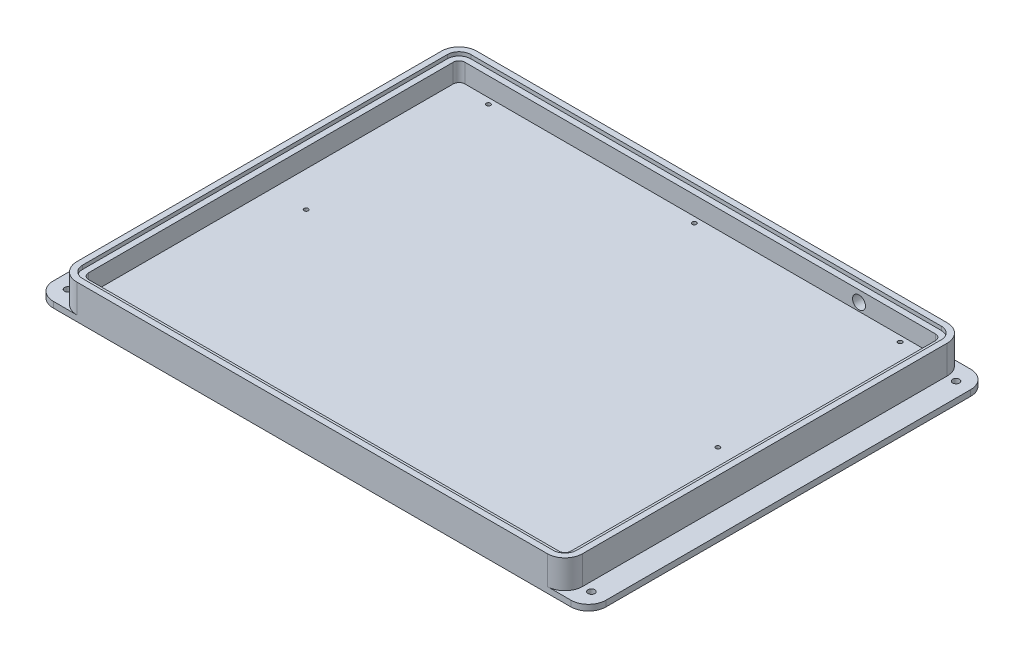
from build123d import *

# Parameters (mm, degrees)
SKETCH1_W           = 273.05
SKETCH1_H           = 215.9
BOSS_EXTRUDE1_DEPTH = 18.542
BOSS_EXTRUDE2_DEPTH = 3.175
FILLET1_R           = 9.525
CUT_EXTRUDE1_DEPTH  = 12.192
CUT_EXTRUDE2_DEPTH  = 2.032
SKETCH5_R           = 1.1303
CUT_EXTRUDE3_DEPTH  = 4.7625
SKETCH6_R           = 3.4925
CUT_EXTRUDE4_DEPTH  = 12.7
SKETCH8_R           = 1.8288
CUT_EXTRUDE5_DEPTH  = 359.471780185


with BuildPart() as part:
    # Sketch1 → Boss-Extrude1 (new body)
    with BuildSketch(Plane(origin=(0, 0, 0), x_dir=(1, 0, 0), z_dir=(0, 1, 0))):
        with Locations((136.525, 107.95)):
            Rectangle(SKETCH1_W, SKETCH1_H)
    extrude(amount=BOSS_EXTRUDE1_DEPTH)

    # Sketch7 → Boss-Extrude2 (add)
    with BuildSketch(Plane.XZ):
        with BuildLine():
            Line((-3.175, 0), (276.225, 0))
            ThreePointArc((276.225, 0), (282.960192091, -2.789807909), (285.75, -9.525))
            Line((285.75, -9.525), (285.75, -206.375))
            ThreePointArc((285.75, -206.375), (282.960192091, -213.110192091), (276.225, -215.9))
            Line((276.225, -215.9), (-3.175, -215.9))
            ThreePointArc((-3.175, -215.9), (-9.910192091, -213.110192091), (-12.7, -206.375))
            Line((-12.7, -206.375), (-12.7, -9.525))
            ThreePointArc((-12.7, -9.525), (-9.910192091, -2.789807909), (-3.175, 0))
        make_face()
    extrude(amount=-BOSS_EXTRUDE2_DEPTH)

    # Fillet1
    fillet1_edges = [part.edges().sort_by_distance(p)[0] for p in [
        (273.05, 10.8585, 0),
        (273.05, 10.8585, -215.9),
        (0, 10.8585, 0),
        (0, 10.8585, -215.9),
    ]]
    fillet(fillet1_edges, radius=FILLET1_R)

    # Sketch3 → Cut-Extrude1 (cut)
    with BuildSketch(Plane(origin=(0, 18.542, 0), x_dir=(1, 0, 0), z_dir=(0, 1, 0))):
        with BuildLine():
            Line((266.7, 9.525), (266.7, 206.375))
            ThreePointArc((266.7, 206.375), (265.77006403, 208.62006403), (263.525, 209.55))
            Line((263.525, 209.55), (9.525, 209.55))
            ThreePointArc((9.525, 209.55), (7.27993597, 208.62006403), (6.35, 206.375))
            Line((6.35, 206.375), (6.35, 9.525))
            ThreePointArc((6.35, 9.525), (7.27993597, 7.27993597), (9.525, 6.35))
            Line((9.525, 6.35), (263.525, 6.35))
            ThreePointArc((263.525, 6.35), (265.77006403, 7.27993597), (266.7, 9.525))
        make_face()
    extrude(amount=-CUT_EXTRUDE1_DEPTH, mode=Mode.SUBTRACT)

    # Sketch4 → Cut-Extrude2 (cut)
    with BuildSketch(Plane(origin=(0, 18.542, 0), x_dir=(1, 0, 0), z_dir=(0, 1, 0))):
        with BuildLine():
            Line((269.875, 9.525), (269.875, 206.375))
            ThreePointArc((269.875, 206.375), (268.015128061, 210.865128061), (263.525, 212.725))
            Line((263.525, 212.725), (9.525, 212.725))
            ThreePointArc((9.525, 212.725), (5.034871939, 210.865128061), (3.175, 206.375))
            Line((3.175, 206.375), (3.175, 9.525))
            ThreePointArc((3.175, 9.525), (5.034871939, 5.034871939), (9.525, 3.175))
            Line((9.525, 3.175), (263.525, 3.175))
            ThreePointArc((263.525, 3.175), (268.015128061, 5.034871939), (269.875, 9.525))
        make_face()
    extrude(amount=-CUT_EXTRUDE2_DEPTH, mode=Mode.SUBTRACT)

    # Sketch5 → Cut-Extrude3 (cut)
    with BuildSketch(Plane(origin=(0, 6.35, 0), x_dir=(1, 0, 0), z_dir=(0, 1, 0))):
        with Locations((25.4, 206.375)):
            Circle(SKETCH5_R)
        with Locations((136.525, 206.375)):
            Circle(SKETCH5_R)
        with Locations((247.65, 206.375)):
            Circle(SKETCH5_R)
        with Locations((247.65, 107.95)):
            Circle(SKETCH5_R)
        with Locations((25.4, 107.95)):
            Circle(SKETCH5_R)
        with Locations((25.4, 9.525)):
            Circle(SKETCH5_R)
        with Locations((136.525, 9.525)):
            Circle(SKETCH5_R)
        with Locations((247.65, 9.525)):
            Circle(SKETCH5_R)
    extrude(amount=-CUT_EXTRUDE3_DEPTH, mode=Mode.SUBTRACT)

    # Sketch6 → Cut-Extrude4 (cut)
    with BuildSketch(Plane(origin=(0, 0, -215.9), x_dir=(-1, 0, 0), z_dir=(0, 0, -1))):
        with Locations((-222.25, 10.6045)):
            Circle(SKETCH6_R)
    extrude(amount=-CUT_EXTRUDE4_DEPTH, mode=Mode.SUBTRACT)

    # Sketch8 → Cut-Extrude5 (cut, through all)
    with BuildSketch(Plane(origin=(0, 3.175, 0), x_dir=(1, 0, 0), z_dir=(0, 1, 0))):
        with Locations((-4.7625, 206.375)):
            Circle(SKETCH8_R)
        with Locations((-4.7625, 9.525)):
            Circle(SKETCH8_R)
        with Locations((277.8125, 9.525)):
            Circle(SKETCH8_R)
        with Locations((277.8125, 206.375)):
            Circle(SKETCH8_R)
    extrude(amount=-CUT_EXTRUDE5_DEPTH, mode=Mode.SUBTRACT)


solid = part.part
